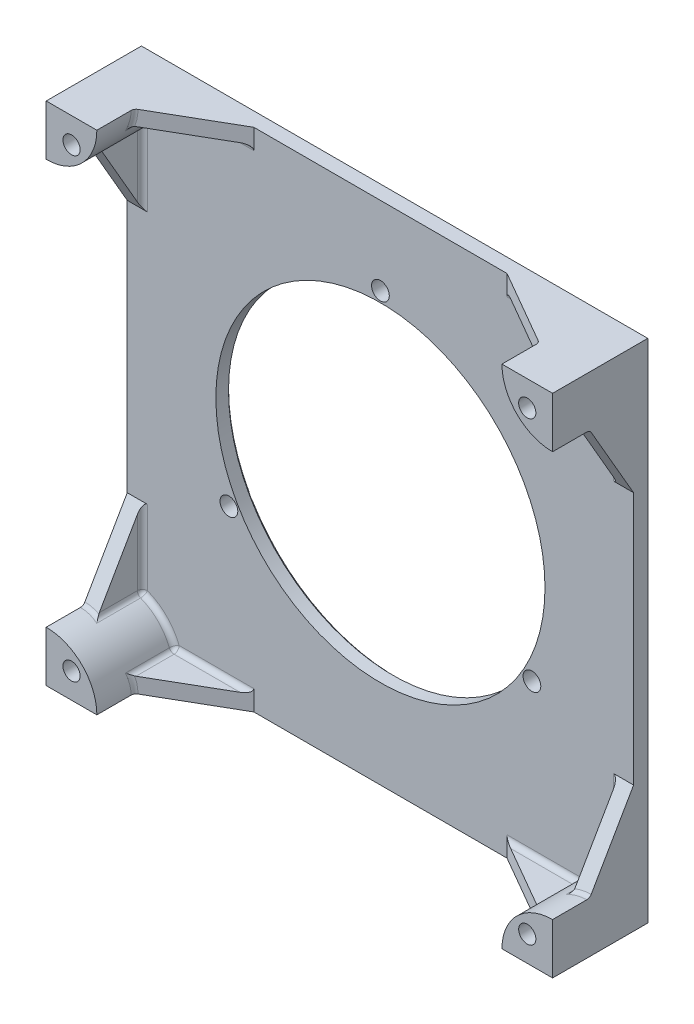
from build123d import *

# Parameters (mm, degrees)
CROQUIS1_W                                           = 100
CROQUIS1_H                                           = 100
CROQUIS1_R                                           = 32.5
CROQUIS1_R_2                                         = 1.75
SALIENTE_EXTRUIR1_DEPTH                              = 3
SALIENTE_EXTRUIR2_DEPTH                              = 16
NERVIO1_REACH                                        = 115.406
CROQUIS3_WALL_W                                      = 246.133206132
CROQUIS3_WALL_H                                      = 3
NERVIO2_REACH                                        = 115.406
CROQUIS4_WALL_W                                      = 246.133206132
CROQUIS4_WALL_H                                      = 3
REDONDEO1_R                                          = 1
REDONDEO1_OF_SIMETR_A1_R                             = 1
CHAFL_N1_SIZE                                        = 0.2
CHAFL_N2_SIZE                                        = 0.5
REFRENTADO_PARA_TORNILLO_CON_CABEZA_TRON_D           = 3.4
REFRENTADO_PARA_TORNILLO_CON_CABEZA_TRON_CBORE_D     = 6
REFRENTADO_PARA_TORNILLO_CON_CABEZA_TRON_CBORE_DEPTH = 2.4


# Read off the part's stored shape, not the designer's step: Simetría2
with BuildPart() as part:
    # Croquis1 → Saliente-Extruir1 (new body)
    with BuildSketch(Plane.XY):
        Rectangle(CROQUIS1_W, CROQUIS1_H)
        Circle(CROQUIS1_R, mode=Mode.SUBTRACT)
        with Locations((0, 34.55)):
            Circle(CROQUIS1_R_2, mode=Mode.SUBTRACT)
        with Locations(Location((-29.921177701, -17.275, 0), (0, 0, 180))):
            Circle(CROQUIS1_R_2, mode=Mode.SUBTRACT)
        with Locations((29.921177701, -17.275)):
            Circle(CROQUIS1_R_2, mode=Mode.SUBTRACT)
    extrude(amount=SALIENTE_EXTRUIR1_DEPTH)

    # Croquis2 → Saliente-Extruir2 (add)
    with BuildSketch(Plane.XY.offset(19)):
        with BuildLine():
            Line((-50, 50), (-50, 40))
            ThreePointArc((-50, 40), (-42.928932188, 42.928932188), (-40, 50))
            Line((-40, 50), (-50, 50))
        make_face()
    saliente_extruir2 = extrude(amount=-SALIENTE_EXTRUIR2_DEPTH)

    # Croquis3 wall → Nervio1 (add, up to next)
    with BuildSketch(Plane(origin=(-50, 32.5, 7.330127019), x_dir=(0, -0.866025403781, -0.500000000007), z_dir=(0, -0.500000000007, 0.866025403781)), mode=Mode.PRIVATE) as nervio1_sk1:
        with Locations((0, 1.5)):
            Rectangle(CROQUIS3_WALL_W, CROQUIS3_WALL_H)
    nervio1_tool1 = extrude(nervio1_sk1.sketch, amount=-NERVIO1_REACH, mode=Mode.PRIVATE) - part.part
    nervio1 = nervio1_tool1.solids().sort_by_distance((-50, 32.5, 7.330127019))[0]
    add(nervio1)

    # Croquis4 wall → Nervio2 (add, up to next)
    with BuildSketch(Plane(origin=(-32.5, 50, 7.330127019), x_dir=(-0.866025403781, 0, 0.500000000007), z_dir=(0.500000000007, 0, 0.866025403781)), mode=Mode.PRIVATE) as nervio2_sk1:
        with Locations((0, 1.5)):
            Rectangle(CROQUIS4_WALL_W, CROQUIS4_WALL_H)
    nervio2_tool1 = extrude(nervio2_sk1.sketch, amount=-NERVIO2_REACH, mode=Mode.PRIVATE) - part.part
    nervio2 = nervio2_tool1.solids().sort_by_distance((-32.5, 50, 7.330127019))[0]
    add(nervio2)

    # Redondeo1
    redondeo1_edges = [part.edges().sort_by_distance(p)[0] for p in [
        (-42.928932188, 42.928932188, 3),
        (-47, 40.460607986, 7.463093091),
        (-48.476785921, 40.116689883, 11.727624973),
        (-47, 32.730303993, 3),
        (-40.460607986, 47, 7.463093091),
        (-40.116689883, 48.476785921, 11.727624973),
        (-32.730303993, 47, 3),
    ]]
    fillet(redondeo1_edges, radius=REDONDEO1_R)

    # Simetría1: Saliente-Extruir2, Nervio1, Nervio2 across plane
    add(saliente_extruir2.mirror(Plane.ZX))
    add(nervio1.mirror(Plane.ZX))
    add(nervio2.mirror(Plane.ZX))

    # Redondeo1 of Simetría1
    redondeo1_of_simetr_a1_edges = [part.edges().sort_by_distance(p)[0] for p in [
        (-42.928932188, -42.928932188, 3),
        (-47, -40.460607986, 7.463093091),
        (-48.476785921, -40.116689883, 11.727624973),
        (-47, -32.730303993, 3),
        (-40.460607986, -47, 7.463093091),
        (-40.116689883, -48.476785921, 11.727624973),
        (-32.730303993, -47, 3),
    ]]
    fillet(redondeo1_of_simetr_a1_edges, radius=REDONDEO1_OF_SIMETR_A1_R)

    # Simetría2: part across plane


with BuildPart() as part_1:
    add(part.part)
    add(part.part.mirror(Plane(origin=(0, 0, 0), x_dir=(0, 0, 1), z_dir=(1, 0, 0))))

    # Chaflán1
    chafl_n1_edges = [part_1.edges().sort_by_distance(p)[0] for p in [
        (0, -50, 0),
        (-50, 0, 0),
        (0, 50, 0),
        (50, 0, 0),
    ]]
    chamfer(chafl_n1_edges, length=CHAFL_N1_SIZE)

    # Chaflán2
    # the kernel refuses this chamfer: 0.5 mm, written as the material it takes off along each edge
    with BuildSketch(Plane(origin=(0, 0, 0), x_dir=(1, 0, 0), z_dir=(0, -1, 0))) as chafl_n2_piece_1:
        Polygon((32.5 + CHAFL_N2_SIZE, 0), (32.5, CHAFL_N2_SIZE), (32.5, 0), align=None)
    revolve(axis=Axis((0, 0, 0), (0, 0, 1)), mode=Mode.SUBTRACT)

    # Refrentado para tornillo con cabeza troncocónica de M31 (through all)
    with Locations(Plane(origin=(0, 0, 0), x_dir=(-1, 0, 0), z_dir=(0, 0, -1))):
        with Locations((-45, -45), (-45, 45), (45, 45), (45, -45)):
            CounterBoreHole(REFRENTADO_PARA_TORNILLO_CON_CABEZA_TRON_D / 2, REFRENTADO_PARA_TORNILLO_CON_CABEZA_TRON_CBORE_D / 2, REFRENTADO_PARA_TORNILLO_CON_CABEZA_TRON_CBORE_DEPTH)


solid = part_1.part
